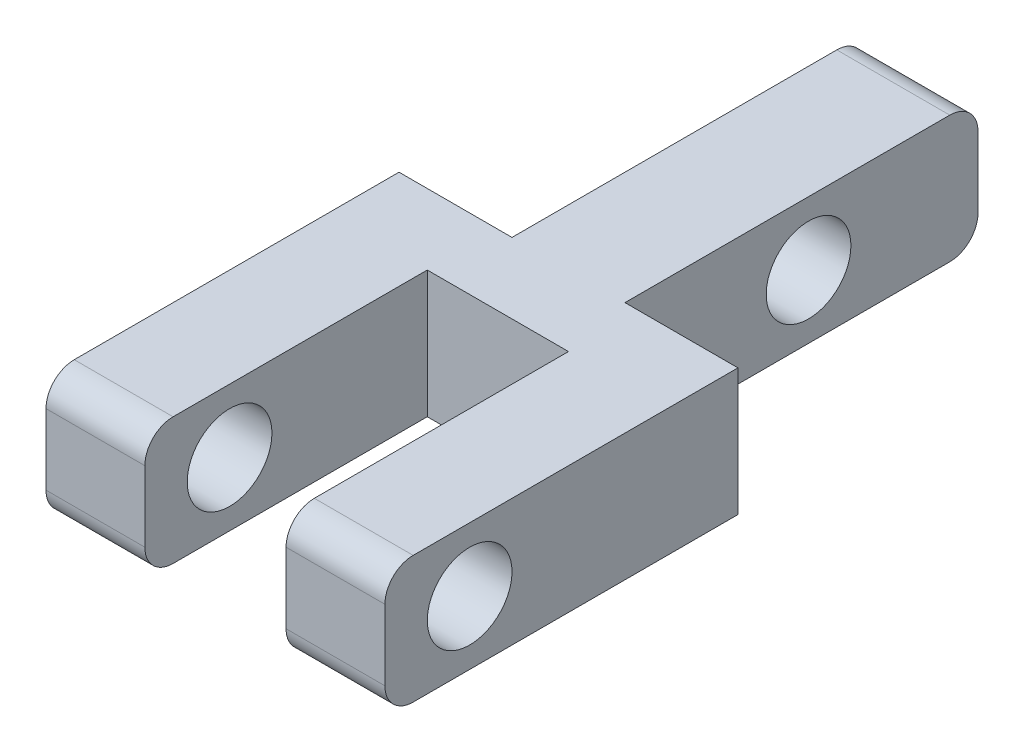
from build123d import *
from build123d.topology import SkipClean

# Parameters (mm, degrees)
SALIENTE_EXTRUIR1_DEPTH    = 2
CORTAR_EXTRUIR1_DEPTH      = 13.857390871
CORTAR_EXTRUIR1_DEPTH_BACK = 13.857390871
CROQUIS2_R                 = 1.5
CROQUIS3_R                 = 1.5
SALIENTE_EXTRUIR2_DEPTH    = 6
CORTAR_EXTRUIR2_DEPTH      = 2.5


with BuildPart() as part:
    # Croquis1 → Saliente-Extruir1 (new, symmetric)
    with BuildSketch(Plane(origin=(0, 0, 0), x_dir=(0, 0, -1), z_dir=(1, 0, 0))):
        with BuildLine():
            Line((-11.5, 2.25), (11.5, 2.25))
            ThreePointArc((11.5, 2.25), (12.207106781, 1.957106781), (12.5, 1.25))
            Line((12.5, 1.25), (12.5, -1.25))
            ThreePointArc((12.5, -1.25), (12.207106781, -1.957106781), (11.5, -2.25))
            Line((11.5, -2.25), (-11.5, -2.25))
            ThreePointArc((-11.5, -2.25), (-12.207106781, -1.957106781), (-12.5, -1.25))
            Line((-12.5, -1.25), (-12.5, 1.25))
            ThreePointArc((-12.5, 1.25), (-12.207106781, 1.957106781), (-11.5, 2.25))
        make_face()
    extrude(amount=SALIENTE_EXTRUIR1_DEPTH, both=True)

    # Croquis2 → Cortar-Extruir1 (cut, two sides: drawn at the far end of the back side and taken through both)
    with BuildSketch(Plane(origin=(0, 0, 0), x_dir=(0, 0, -1), z_dir=(1, 0, 0)).offset(-CORTAR_EXTRUIR1_DEPTH_BACK)):
        with Locations((-9.5, 0)):
            Circle(CROQUIS2_R)
        with Locations((6.5, 0)):
            Circle(CROQUIS2_R)
    extrude(amount=CORTAR_EXTRUIR1_DEPTH + CORTAR_EXTRUIR1_DEPTH_BACK, mode=Mode.SUBTRACT)

    # Croquis3 → Saliente-Extruir2 (add, symmetric)
    with SkipClean():  # the faces are left unmerged after this step: merging them gives an invalid solid
        with BuildSketch(Plane(origin=(0, 0, 0), x_dir=(0, 0, -1), z_dir=(1, 0, 0))):
            with BuildLine():
                Line((-12.5, 1.25), (-12.5, -1.25))
                ThreePointArc((-12.5, -1.25), (-12.207106781, -1.957106781), (-11.5, -2.25))
                Line((-11.5, -2.25), (0, -2.25))
                Line((0, -2.25), (0, 2.25))
                Line((0, 2.25), (-11.5, 2.25))
                ThreePointArc((-11.5, 2.25), (-12.207106781, 1.957106781), (-12.5, 1.25))
            make_face()
            with Locations((-9.5, 0)):
                Circle(CROQUIS3_R, mode=Mode.SUBTRACT)
        extrude(amount=SALIENTE_EXTRUIR2_DEPTH, both=True)
    add(part.part.scale(1), mode=Mode.REPLACE)  # the faces are merged on a copy

    # Croquis4 → Cortar-Extruir2 (cut, symmetric)
    with BuildSketch(Plane(origin=(0, 0, 0), x_dir=(0, 0, -1), z_dir=(1, 0, 0))):
        with BuildLine():
            Line((-11.5, 2.25), (-2.5, 2.25))
            Line((-2.5, 2.25), (-2.5, -2.25))
            Line((-2.5, -2.25), (-11.5, -2.25))
            ThreePointArc((-11.5, -2.25), (-12.207106781, -1.957106781), (-12.5, -1.25))
            Line((-12.5, -1.25), (-12.5, 1.25))
            ThreePointArc((-12.5, 1.25), (-12.207106781, 1.957106781), (-11.5, 2.25))
        make_face()
    extrude(amount=CORTAR_EXTRUIR2_DEPTH, both=True, mode=Mode.SUBTRACT)


solid = part.part
